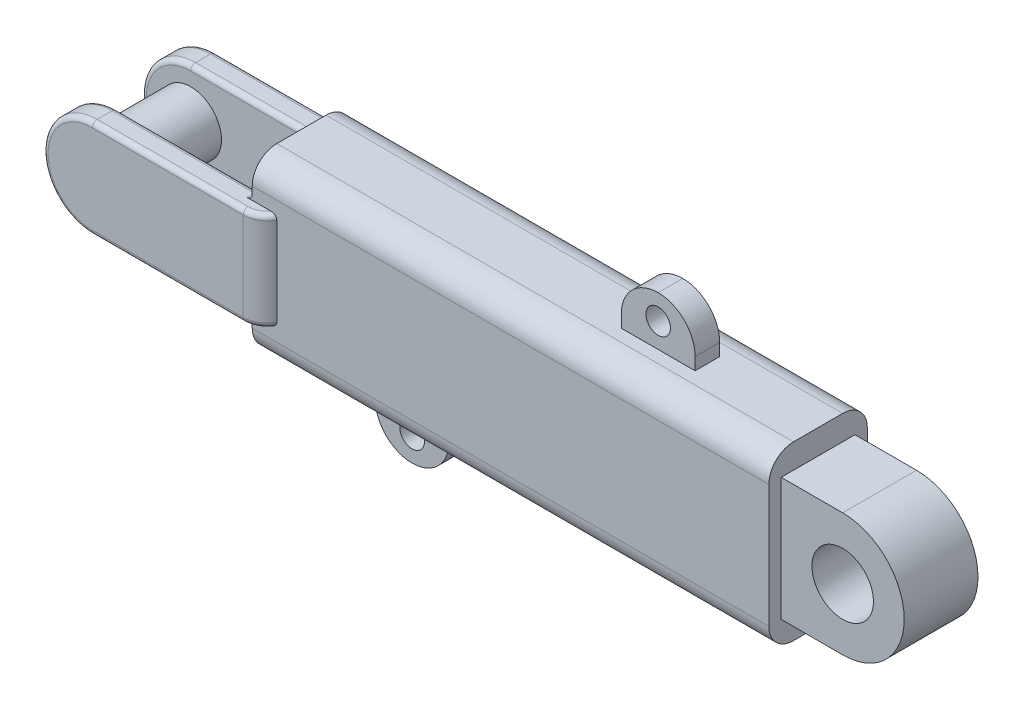
from build123d import *

# Parameters (mm, degrees)
BOSS_EXTRUDE1_DEPTH      = 25
BOSS_EXTRUDE1_DEPTH_BACK = 25
SKETCH2_W                = 30
SKETCH2_H                = 40
CUT_EXTRUDE1_DEPTH       = 96.524865873
BOSS_EXTRUDE2_REACH      = 90.318
SKETCH3_R                = 12.5
STRUCTURAL_MEMBER1_DEPTH = 200
BOSS_EXTRUDE3_DEPTH      = 10
BOSS_EXTRUDE4_DEPTH      = 50
BOSS_EXTRUDE4_DEPTH_BACK = 10
CUT_EXTRUDE6_START       = -30
CUT_EXTRUDE6_DEPTH       = 30
SKETCH16_R               = 12.5
CUT_EXTRUDE7_DEPTH       = 325.384031666
FILLET1_R                = 10
FILLET2_R                = 2
FILLET3_R                = 2
SKETCH19_W               = 30
SKETCH19_H               = 10
BOSS_EXTRUDE6_DEPTH      = 20
FILLET5_R                = 15
CUT_EXTRUDE8_REACH       = 328.075
SKETCH20_R               = 5
FILLET5_OF_MIRROR9_R     = 15
LPATTERN1_START          = -5
LPATTERN1_OUTLINE_R      = 5
LPATTERN1_DEPTH          = 10
CUT_EXTRUDE9_START       = 35
CUT_EXTRUDE9_OUTLINE_W   = 30
CUT_EXTRUDE9_OUTLINE_H   = 10
CUT_EXTRUDE9_DEPTH       = 20
CUT_EXTRUDE10_START      = -25
CUT_EXTRUDE10_OUTLINE_R  = 5
CUT_EXTRUDE10_DEPTH      = 10


# Read off the part's stored shape, not the designer's step: Cut-Extrude6, LPattern1, Cut-Extrude9, Cut-Extrude10
# Some blends are built 0.0001 mm under size
with BuildPart() as part:
    # Sketch1 → Boss-Extrude1 (new, two sides: drawn at the far end of the back side and taken through both)
    with BuildSketch(Plane.XY.offset(-BOSS_EXTRUDE1_DEPTH_BACK)):
        with BuildLine():
            Line((0, 20), (70, 20))
            Line((70, 20), (70, -20))
            Line((70, -20), (0, -20))
            ThreePointArc((0, -20), (-20, 0), (0, 20))
        make_face()
    extrude(amount=BOSS_EXTRUDE1_DEPTH + BOSS_EXTRUDE1_DEPTH_BACK)

    # Sketch2 → Cut-Extrude1 (cut, through all)
    with BuildSketch(Plane(origin=(70, 0, 0), x_dir=(0, 0, -1), z_dir=(1, 0, 0))):
        Rectangle(SKETCH2_W, SKETCH2_H)
    extrude(amount=-CUT_EXTRUDE1_DEPTH, mode=Mode.SUBTRACT)


with BuildPart() as cut_extrude1_piece_1:
    # of the separate pieces the step leaves, piece 1, a body of its own (cut_extrude1_pieces)
    add(part.part.solids().sort_by_distance((0, 20, -25))[0])

    # Sketch3 → Boss-Extrude2 (add, up to next)
    with BuildSketch(Plane.XY.offset(25), mode=Mode.PRIVATE) as boss_extrude2_sk1:
        Circle(SKETCH3_R)
    boss_extrude2_tool1 = extrude(boss_extrude2_sk1.sketch, amount=-BOSS_EXTRUDE2_REACH, mode=Mode.PRIVATE) - cut_extrude1_piece_1.part


with BuildPart() as cut_extrude1_piece_2:
    # of the separate pieces the step leaves, piece 2, a body of its own (cut_extrude1_pieces)
    add(part.part.solids().sort_by_distance((0, 20, 15))[0])


with BuildPart() as cut_extrude1_piece_1_1:
    add(cut_extrude1_piece_1.part)

    add(cut_extrude1_piece_2.part)  # Boss-Extrude2 merges Cut-Extrude1 piece 2
    add(boss_extrude2_tool1.solids().sort_by_distance((0, 0, 25))[0])



with BuildPart() as body_2:
    # Sketch11 → Structural Member1 (new body)
    with BuildSketch(Plane(origin=(70, 0, 0), x_dir=(0, 0, 1), z_dir=(1, 0, 0))):
        with BuildLine():
            Line((-10, -35), (10, -35))
            ThreePointArc((10, -35), (17.071067812, -32.071067812), (20, -25))
            Line((20, -25), (20, 25))
            ThreePointArc((20, 25), (17.071067812, 32.071067812), (10, 35))
            Line((10, 35), (-10, 35))
            ThreePointArc((-10, 35), (-17.071067812, 32.071067812), (-20, 25))
            Line((-20, 25), (-20, -25))
            ThreePointArc((-20, -25), (-17.071067812, -32.071067812), (-10, -35))
        make_face()
        with BuildLine():
            Line((-10, -30), (10, -30))
            ThreePointArc((10, -30), (13.535533906, -28.535533906), (15, -25))
            Line((15, -25), (15, 25))
            ThreePointArc((15, 25), (13.535533906, 28.535533906), (10, 30))
            Line((10, 30), (-10, 30))
            ThreePointArc((-10, 30), (-13.535533906, 28.535533906), (-15, 25))
            Line((-15, 25), (-15, -25))
            ThreePointArc((-15, -25), (-13.535533906, -28.535533906), (-10, -30))
        make_face(mode=Mode.SUBTRACT)
    extrude(amount=STRUCTURAL_MEMBER1_DEPTH)


with BuildPart() as cut_extrude1_piece_1_2:
    add(cut_extrude1_piece_1_1.part)

    add(body_2.part)  # Boss-Extrude3 merges body 2
    # Sketch12 → Boss-Extrude3 (add)
    with BuildSketch(Plane.ZY.offset(-70)):
        with BuildLine():
            Line((20, -25), (20, 25))
            ThreePointArc((20, 25), (17.071067812, 32.071067812), (10, 35))
            Line((10, 35), (-10, 35))
            ThreePointArc((-10, 35), (-17.071067812, 32.071067812), (-20, 25))
            Line((-20, 25), (-20, -25))
            ThreePointArc((-20, -25), (-17.071067812, -32.071067812), (-10, -35))
            Line((-10, -35), (10, -35))
            ThreePointArc((10, -35), (17.071067812, -32.071067812), (20, -25))
        make_face()
    extrude(amount=BOSS_EXTRUDE3_DEPTH)

    # Sketch14 → Boss-Extrude4 (add, two sides: drawn at the far end of the back side and taken through both)
    with BuildSketch(Plane(origin=(270, 0, 0), x_dir=(0, 0, -1), z_dir=(1, 0, 0)).offset(-BOSS_EXTRUDE4_DEPTH_BACK)):
        with BuildLine():
            Line((15, -25), (15, 25))
            ThreePointArc((15, 25), (13.535533906, 28.535533906), (10, 30))
            Line((10, 30), (-10, 30))
            ThreePointArc((-10, 30), (-13.535533906, 28.535533906), (-15, 25))
            Line((-15, 25), (-15, -25))
            ThreePointArc((-15, -25), (-13.535533906, -28.535533906), (-10, -30))
            Line((-10, -30), (10, -30))
            ThreePointArc((10, -30), (13.535533906, -28.535533906), (15, -25))
        make_face()
    extrude(amount=BOSS_EXTRUDE4_DEPTH + BOSS_EXTRUDE4_DEPTH_BACK)

    # Cut-Extrude6 outline → Cut-Extrude6 (cut)
    with BuildSketch(Plane.XY.offset(15).offset(CUT_EXTRUDE6_START)):
        with BuildLine():
            Line((270, -25), (270, -30))
            Line((270, -30), (320, -30))
            Line((320, -30), (320, -2.73e-07))
            ThreePointArc((320, -2.73e-07), (312.677669433, -17.677669626), (295, -25))
            Line((295, -25), (270, -25))
        make_face()
        with BuildLine():
            Line((270, 30), (270, 25))
            Line((270, 25), (295, 25))
            ThreePointArc((295, 25), (312.677669626, 17.677669433), (320, -2.73e-07))
            Line((320, -2.73e-07), (320, 30))
            Line((320, 30), (270, 30))
        make_face()
    extrude(amount=CUT_EXTRUDE6_DEPTH, mode=Mode.SUBTRACT)

    # Sketch16 → Cut-Extrude7 (cut, through all)
    with BuildSketch(Plane.XY.offset(15)):
        with Locations((295, 0)):
            Circle(SKETCH16_R)
    extrude(amount=-CUT_EXTRUDE7_DEPTH, mode=Mode.SUBTRACT)

    # Fillet1
    # the kernel refuses this fillet: 10 mm, written as the material it takes off along each edge
    with BuildSketch(Plane(origin=(70, 41.650635095, -25), x_dir=(0, 0, 1), z_dir=(0, -1, 0))) as fillet1_piece_1:
        with BuildLine():
            CenterArc((10, 8.660254038), FILLET1_R, 180, 60)
            Line((0, 8.660254038), (-0.2, 8.660254038))
            Line((-0.2, 8.660254038), (-0.2, 0))
            Line((-0.2, 0), (0, -0.2))
            ThreePointArc((0, -0.2), (2.5, -0.2), (4.9, -0.173205081))
            Line((4.9, -0.173205081), (5, 0))
        make_face()
    extrude(amount=83.301270189, mode=Mode.SUBTRACT)
    with BuildSketch(Plane(origin=(70, 41.650635095, 25), x_dir=(0, 0, -1), z_dir=(0, -1, 0))) as fillet1_piece_2:
        with BuildLine():
            CenterArc((10, -8.660254038), FILLET1_R, 120, 60)
            Line((0, -8.660254038), (-0.2, -8.660254038))
            Line((-0.2, -8.660254038), (-0.2, 0))
            Line((-0.2, 0), (0, 0.2))
            ThreePointArc((0, 0.2), (2.5, 0.2), (4.9, 0.173205081))
            Line((4.9, 0.173205081), (5, 0))
        make_face()
    extrude(amount=83.301270189, mode=Mode.SUBTRACT)

    # Fillet2
    fillet2_edges = [cut_extrude1_piece_1_2.edges().sort_by_distance(p)[0] for p in [
        (-12.5, 0, 15),
        (30, 20, -15),
        (-20, 0, -15),
        (30, -20, -15),
        (-20, 0, 15),
        (30, 20, 15),
        (60, 0, -15),
        (30, -20, 15),
        (60, 0, 15),
        (60, 20, 17.5),
        (60, 20, -17.5),
        (60, -20, -17.5),
        (60, -20, 17.5),
    ]]
    fillet(fillet2_edges, radius=FILLET2_R)

    # Fillet3
    fillet3_edges = [cut_extrude1_piece_1_2.edges().sort_by_distance(p)[0] for p in [
        (66.339745962, 20, 23.660254038),
        (30.669872981, 20, 25),
        (-20, 0, 25),
        (66.339745962, -20, 23.660254038),
        (66.339745962, 20, -23.660254038),
        (30.669872981, 20, -25),
        (-20, 0, -25),
        (66.339745962, -20, -23.660254038),
        (30.669872981, -20, 25),
        (30.669872981, -20, -25),
    ]]
    fillet(fillet3_edges, radius=FILLET3_R)

    # Sketch19 → Boss-Extrude6 (add)
    with BuildSketch(Plane.XZ.offset(35)):
        with Locations((110, 0)):
            Rectangle(SKETCH19_W, SKETCH19_H)
    boss_extrude6 = extrude(amount=BOSS_EXTRUDE6_DEPTH)

    # Fillet5
    fillet5_edges = [cut_extrude1_piece_1_2.edges().sort_by_distance(p)[0] for p in [
        (95, -55, 0),
        (125, -55, 0),
    ]]
    fillet(fillet5_edges, radius=FILLET5_R - 0.0001)  # a hair under: the kernel refuses the full size

    # Sketch20 → Cut-Extrude8 (cut, up to next)
    with BuildSketch(Plane.XY.offset(5), mode=Mode.PRIVATE) as cut_extrude8_sk1:
        with Locations((110, -45)):
            Circle(SKETCH20_R)
    cut_extrude8_tool1 = extrude(cut_extrude8_sk1.sketch, amount=-CUT_EXTRUDE8_REACH, mode=Mode.PRIVATE) & cut_extrude1_piece_1_2.part
    cut_extrude8 = cut_extrude8_tool1.solids().sort_by_distance((110, -45, 5))[0]
    add(cut_extrude8, mode=Mode.SUBTRACT)

    # Mirror9: Boss-Extrude6, Cut-Extrude8 across plane
    add(boss_extrude6.mirror(Plane.ZX))
    add(cut_extrude8.mirror(Plane.ZX), mode=Mode.SUBTRACT)

    # Fillet5 of Mirror9
    fillet5_of_mirror9_edges = [cut_extrude1_piece_1_2.edges().sort_by_distance(p)[0] for p in [
        (95, 55, 0),
        (125, 55, 0),
    ]]
    fillet(fillet5_of_mirror9_edges, radius=FILLET5_OF_MIRROR9_R - 0.0001)  # a hair under: the kernel refuses the full size

    # LPattern1 outline → LPattern1 (add)
    # profile 1 of 2: a face of its own
    with BuildSketch(Plane.XY.offset(LPATTERN1_START)):
        with BuildLine():
            Line((195, 35), (225, 35))
            Line((225, 35), (225, 40))
            ThreePointArc((225, 40), (220.606601718, 50.606601718), (210, 55))
            ThreePointArc((210, 55), (199.393398282, 50.606601718), (195, 40))
            Line((195, 40), (195, 35))
        make_face()
        with Locations((210, 45)):
            Circle(LPATTERN1_OUTLINE_R, mode=Mode.SUBTRACT)
    # profile 2 of 2: a face of its own
    with BuildSketch(Plane.XY.offset(LPATTERN1_START)):
        with BuildLine():
            Line((225, -40), (225, -35))
            Line((225, -35), (195, -35))
            Line((195, -35), (195, -40))
            ThreePointArc((195, -40), (199.393398282, -50.606601718), (210, -55))
            ThreePointArc((210, -55), (220.606601718, -50.606601718), (225, -40))
        make_face()
        with Locations((210, -45)):
            Circle(LPATTERN1_OUTLINE_R, mode=Mode.SUBTRACT)
    extrude(amount=LPATTERN1_DEPTH)

    # Cut-Extrude9 outline → Cut-Extrude9 (cut)
    with BuildSketch(Plane(origin=(0, 0, 0), x_dir=(1, 0, 0), z_dir=(0, 1, 0)).offset(CUT_EXTRUDE9_START)):
        with Locations((110, 0)):
            Rectangle(CUT_EXTRUDE9_OUTLINE_W, CUT_EXTRUDE9_OUTLINE_H)
    extrude(amount=CUT_EXTRUDE9_DEPTH, mode=Mode.SUBTRACT)

    # Cut-Extrude10 outline → Cut-Extrude10 (cut)
    with BuildSketch(Plane.XY.offset(20).offset(CUT_EXTRUDE10_START)):
        with BuildLine():
            Line((225, -40), (225, -35))
            Line((225, -35), (195, -35))
            Line((195, -35), (195, -40))
            ThreePointArc((195, -40), (199.393398282, -50.606601718), (210, -55))
            ThreePointArc((210, -55), (220.606601718, -50.606601718), (225, -40))
        make_face()
        with Locations((210, -45)):
            Circle(CUT_EXTRUDE10_OUTLINE_R, mode=Mode.SUBTRACT)
    extrude(amount=CUT_EXTRUDE10_DEPTH, mode=Mode.SUBTRACT)


solid = cut_extrude1_piece_1_2.part
